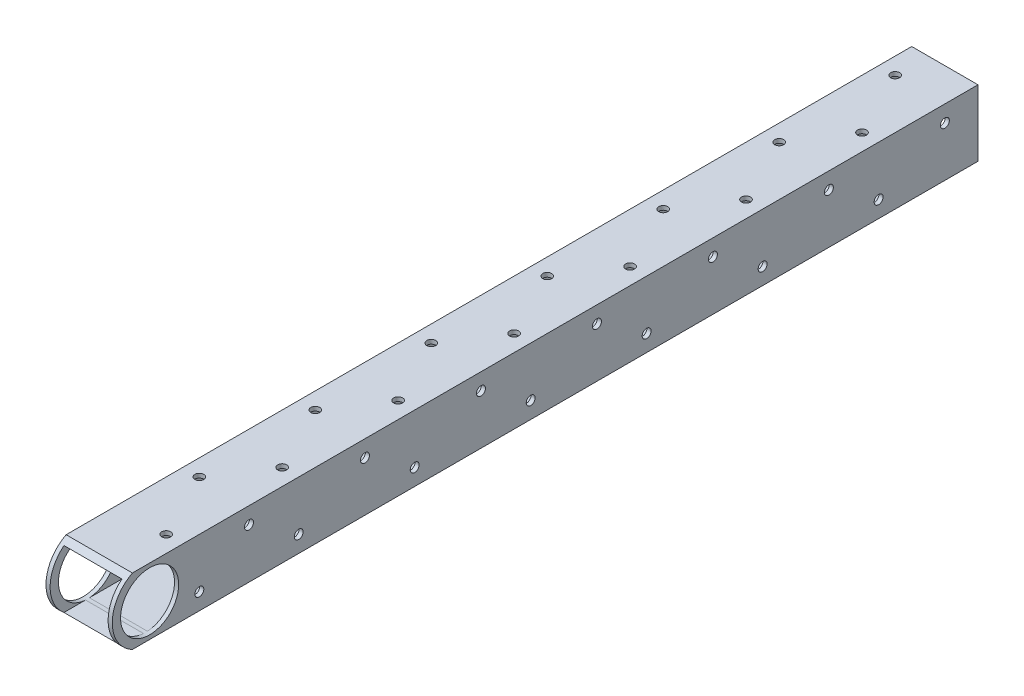
from build123d import *

# Parameters (mm, degrees)
SKETCH1_W                        = 25.4
SKETCH1_H                        = 25.4
SKETCH1_W_2                      = 22.225
SKETCH1_H_2                      = 22.225
EXTRUDE_THIN1_DEPTH              = 168.275
SKETCH2_R                        = 11.1379
CUT_EXTRUDE1_DEPTH               = 171.65440406
CUT_EXTRUDE2_DEPTH               = 171.65440406
F_1_8_0_135_DIAMETER_HOLE1_D     = 3.429
F_1_8_0_135_DIAMETER_HOLE1_DEPTH = 16.51
F_1_8_0_135_DIAMETER_HOLE1_TIP   = 1.030175531
F_1_8_0_135_DIAMETER_HOLE4_D     = 3.429
F_1_8_0_135_DIAMETER_HOLE4_DEPTH = 3.429
F_1_8_0_135_DIAMETER_HOLE4_TIP   = 1.030175531


with BuildPart() as part:
    # Sketch1 → Extrude-Thin1 (new, symmetric)
    with BuildSketch(Plane.XY):
        Rectangle(SKETCH1_W, SKETCH1_H)
        Rectangle(SKETCH1_W_2, SKETCH1_H_2, mode=Mode.SUBTRACT)
    extrude(amount=EXTRUDE_THIN1_DEPTH, both=True)

    # Sketch2 → Cut-Extrude1 (cut, through all)
    with BuildSketch(Plane(origin=(12.7, 0, 0), x_dir=(0, 0, -1), z_dir=(1, 0, 0))):
        with Locations((-149.225, 0)):
            Circle(SKETCH2_R)
    extrude(amount=-CUT_EXTRUDE1_DEPTH, mode=Mode.SUBTRACT)

    # Sketch3 → Cut-Extrude2 (cut, through all)
    with BuildSketch(Plane(origin=(12.7, 0, 0), x_dir=(0, 0, -1), z_dir=(1, 0, 0))):
        with BuildLine():
            Line((-149.225, 14.3129), (-168.275, 14.3129))
            Line((-168.275, 14.3129), (-168.275, -12.7))
            Line((-168.275, -12.7), (-155.825689843, -12.7))
            ThreePointArc((-155.825689843, -12.7), (-163.128829264, 3.397445835), (-149.225, 14.3129))
        make_face()
    extrude(amount=-CUT_EXTRUDE2_DEPTH, mode=Mode.SUBTRACT)

    # 1/8 (0.135) Diameter Hole1
    with Locations(Plane(origin=(12.7, 0, 0), x_dir=(0, 0, -1), z_dir=(1, 0, 0))):
        with Locations((-111.125, 6.35), (-92.075, -6.35), (-66.675, 6.35), (-47.625, -6.35), (-22.225, 6.35), (-3.175, -6.35), (22.225, 6.35), (41.275, -6.35), (66.675, 6.35), (85.725, -6.35), (111.125, 6.35), (130.175, -6.35), (155.575, 6.35), (-130.175, -6.35)):
            Hole(F_1_8_0_135_DIAMETER_HOLE1_D / 2, depth=F_1_8_0_135_DIAMETER_HOLE1_DEPTH)
            with Locations((0, 0, -(F_1_8_0_135_DIAMETER_HOLE1_DEPTH + F_1_8_0_135_DIAMETER_HOLE1_TIP / 2))):  # 118° drill point
                Cone(0, F_1_8_0_135_DIAMETER_HOLE1_D / 2, F_1_8_0_135_DIAMETER_HOLE1_TIP, mode=Mode.SUBTRACT)

    # 1/8 (0.135) Diameter Hole4
    with Locations(Plane(origin=(0, 12.7, 0), x_dir=(-1, 0, 0), z_dir=(0, 1, 0))):
        with Locations((-6.35, 136.525), (6.35, 111.125), (-6.35, 92.075), (6.35, 66.675), (-6.35, 47.625), (6.35, 22.225), (-6.35, 3.175), (6.35, -22.225), (-6.35, -41.275), (6.35, -66.675), (-6.35, -85.725), (6.35, -111.125), (-6.35, -130.175), (6.35, -155.575)):
            Hole(F_1_8_0_135_DIAMETER_HOLE4_D / 2, depth=F_1_8_0_135_DIAMETER_HOLE4_DEPTH)
            with Locations((0, 0, -(F_1_8_0_135_DIAMETER_HOLE4_DEPTH + F_1_8_0_135_DIAMETER_HOLE4_TIP / 2))):  # 118° drill point
                Cone(0, F_1_8_0_135_DIAMETER_HOLE4_D / 2, F_1_8_0_135_DIAMETER_HOLE4_TIP, mode=Mode.SUBTRACT)


solid = part.part
